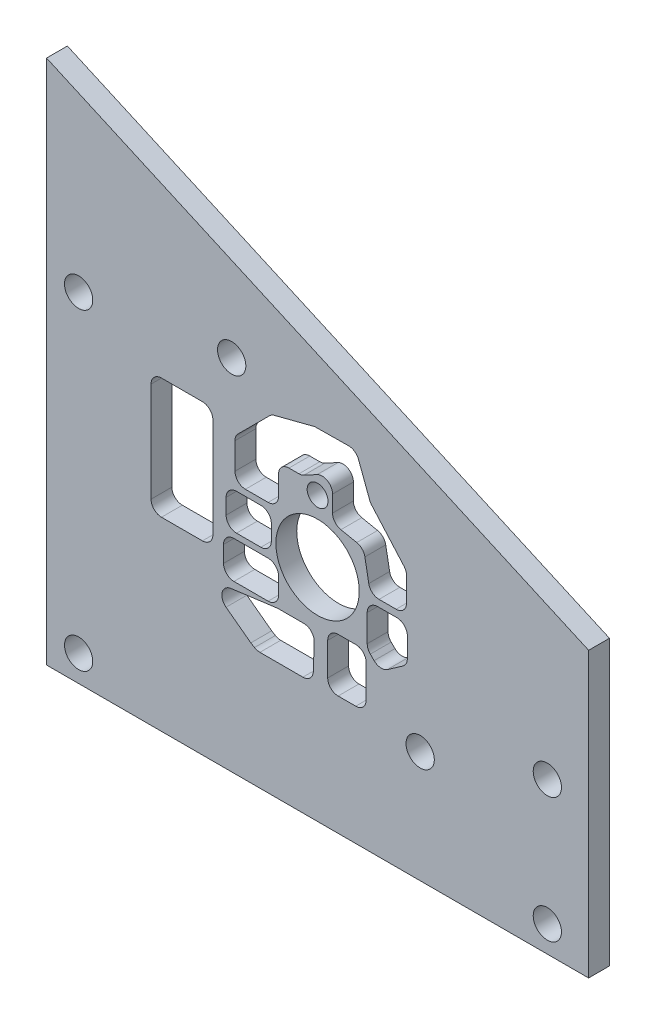
from build123d import *

# Parameters (mm, degrees)
BOSS_EXTRUDE1_DEPTH          = 3.175
F_6_CLEARANCE_HOLE1_D        = 4.3053
F_1_2_0_5_DIAMETER_HOLE1_D   = 12.7
F_1_8_0_125_DIAMETER_HOLE1_D = 3.175
CUT_EXTRUDE1_DEPTH           = 127.083883288
SKETCH10_W                   = 82.55
SKETCH10_H                   = 13.462
CUT_EXTRUDE2_DEPTH           = 125.775859018
CUT_EXTRUDE3_DEPTH           = 125.775859018


with BuildPart() as part:
    # Sketch1 → Boss-Extrude1 (new body)
    with BuildSketch(Plane.XY):
        with BuildLine():
            Line((49.022, 13.462), (57.658, 13.462))
            ThreePointArc((57.658, 13.462), (61.250102448, 11.974102448), (62.738, 8.382))
            Line((62.738, 8.382), (62.738, 0))
            Line((62.738, 0), (82.55, 0))
            Line((82.55, 0), (82.55, 58.42))
            Line((82.55, 58.42), (0, 95.25))
            Line((0, 95.25), (0, 0))
            Line((0, 0), (43.942, 0))
            Line((43.942, 0), (43.942, 8.382))
            ThreePointArc((43.942, 8.382), (45.429897552, 11.974102448), (49.022, 13.462))
        make_face()
    extrude(amount=-BOSS_EXTRUDE1_DEPTH)

    # #6 Clearance Hole1 (through all)
    with Locations(Plane(origin=(0, 0, -3.175), x_dir=(-1, 0, 0), z_dir=(0, 0, -1))):
        with Locations((-4.8895, 17.4625), (-4.8895, 65.0875), (-76.2635, 36.5125), (-76.2635, 17.4625), (-28.194, 68.072), (-56.896, 30.48)):
            Hole(F_6_CLEARANCE_HOLE1_D / 2)

    # 1/2 (0.5) Diameter Hole1 (through all)
    with Locations(Plane(origin=(0, 0, -3.175), x_dir=(-1, 0, 0), z_dir=(0, 0, -1))):
        with Locations((-41.275, 46.99)):
            Hole(F_1_2_0_5_DIAMETER_HOLE1_D / 2)

    # 1/8 (0.125) Diameter Hole1 (through all)
    with Locations(Plane.XY):
        with Locations((41.275, 56.488873013)):
            Hole(F_1_8_0_125_DIAMETER_HOLE1_D / 2)

    # Sketch9 → Cut-Extrude1 (cut, through all)
    with BuildSketch(Plane.XY):
        Polygon((82.55, 56.681667019), (0, 93.511667019), (0, 95.25), (82.55, 58.42), align=None)
    extrude(amount=-CUT_EXTRUDE1_DEPTH, mode=Mode.SUBTRACT)

    # Sketch10 → Cut-Extrude2 (cut, through all)
    with BuildSketch(Plane.XY):
        with Locations((41.275, 6.731)):
            Rectangle(SKETCH10_W, SKETCH10_H)
    extrude(amount=-CUT_EXTRUDE2_DEPTH, mode=Mode.SUBTRACT)

    # Sketch11 → Cut-Extrude3 (cut, through all)
    with BuildSketch(Plane(origin=(0, 0, -3.175), x_dir=(-1, 0, 0), z_dir=(0, 0, -1))):
        with BuildLine():
            Line((-47.499382893, 64.350043571), (-49.217838976, 59.797014184))
            ThreePointArc((-49.217838976, 59.797014184), (-49.342602584, 59.539490696), (-49.511570199, 59.308548605))
            Line((-49.511570199, 59.308548605), (-54.424737937, 53.728160557))
            ThreePointArc((-54.424737937, 53.728160557), (-54.718441496, 53.239768266), (-54.820737184, 52.679121851))
            Line((-54.820737184, 52.679121851), (-54.820737184, 49.028223087))
            ThreePointArc((-54.820737184, 49.028223087), (-54.355769199, 47.905691072), (-53.233237184, 47.440723087))
            Line((-53.233237184, 47.440723087), (-50.632018094, 47.440723087))
            ThreePointArc((-50.632018094, 47.440723087), (-49.615422508, 47.808924245), (-49.070400683, 48.742728232))
            Line((-49.070400683, 48.742728232), (-48.481044321, 51.966426108))
            ThreePointArc((-48.481044321, 51.966426108), (-48.053344478, 52.791961047), (-47.236701236, 53.236403289))
            Line((-47.236701236, 53.236403289), (-44.826272839, 53.728065645))
            ThreePointArc((-44.826272839, 53.728065645), (-43.913947791, 54.279425321), (-43.556047165, 55.28353768))
            Line((-43.556047165, 55.28353768), (-43.556047165, 57.78867138))
            ThreePointArc((-43.556047165, 57.78867138), (-42.781378772, 59.152291939), (-41.213419098, 59.185073132))
            Line((-41.213419098, 59.185073132), (-39.194265812, 58.093181549))
            ThreePointArc((-39.194265812, 58.093181549), (-38.828604347, 57.950599215), (-38.439137744, 57.902083301))
            Line((-38.439137744, 57.902083301), (-36.91898292, 57.902083301))
            ThreePointArc((-36.91898292, 57.902083301), (-35.796450905, 57.437115316), (-35.33148292, 56.314583301))
            Line((-35.33148292, 56.314583301), (-35.33148292, 53.371319843))
            ThreePointArc((-35.33148292, 53.371319843), (-34.866514936, 52.248787828), (-33.74398292, 51.783819843))
            Line((-33.74398292, 51.783819843), (-30.284464792, 51.783819843))
            ThreePointArc((-30.284464792, 51.783819843), (-29.161932777, 52.248787828), (-28.696964792, 53.371319843))
            Line((-28.696964792, 53.371319843), (-28.696964792, 57.39464551))
            ThreePointArc((-28.696964792, 57.39464551), (-28.817806034, 58.002155459), (-29.161932777, 58.517177525))
            Line((-29.161932777, 58.517177525), (-33.960282123, 63.315526871))
            ThreePointArc((-33.960282123, 63.315526871), (-34.294903906, 63.571165279), (-34.684964472, 63.729833134))
            Line((-34.684964472, 63.729833134), (-40.63768141, 65.270845279))
            ThreePointArc((-40.63768141, 65.270845279), (-40.826231645, 65.307649272), (-41.017846908, 65.3214085))
            Line((-41.017846908, 65.3214085), (-45.99646675, 65.376871943))
            ThreePointArc((-45.99646675, 65.376871943), (-46.909705645, 65.100248069), (-47.499382893, 64.350043571))
        make_face()
        with BuildLine():
            Line((-32.646432346, 50.840755102), (-28.930085764, 50.840755102))
            ThreePointArc((-28.930085764, 50.840755102), (-27.807553749, 50.375787118), (-27.342585764, 49.253255102))
            Line((-27.342585764, 49.253255102), (-27.342585764, 46.905517071))
            ThreePointArc((-27.342585764, 46.905517071), (-27.807553749, 45.782985055), (-28.930085764, 45.318017071))
            Line((-28.930085764, 45.318017071), (-32.646432346, 45.318017071))
            ThreePointArc((-32.646432346, 45.318017071), (-33.768964361, 45.782985055), (-34.233932346, 46.905517071))
            Line((-34.233932346, 46.905517071), (-34.233932346, 49.253255102))
            ThreePointArc((-34.233932346, 49.253255102), (-33.768964361, 50.375787118), (-32.646432346, 50.840755102))
        make_face()
        with BuildLine():
            Line((-35.33148292, 42.840265572), (-35.33148292, 40.343410335))
            ThreePointArc((-35.33148292, 40.343410335), (-34.866514936, 39.22087832), (-33.74398292, 38.755910335))
            Line((-33.74398292, 38.755910335), (-28.540105865, 38.755910335))
            ThreePointArc((-28.540105865, 38.755910335), (-27.41757385, 39.22087832), (-26.952605865, 40.343410335))
            Line((-26.952605865, 40.343410335), (-26.952605865, 42.840265572))
            ThreePointArc((-26.952605865, 42.840265572), (-27.41757385, 43.962797587), (-28.540105865, 44.427765572))
            Line((-28.540105865, 44.427765572), (-33.74398292, 44.427765572))
            ThreePointArc((-33.74398292, 44.427765572), (-34.866514936, 43.962797587), (-35.33148292, 42.840265572))
        make_face()
        with BuildLine():
            Line((-39.176026782, 38.541010778), (-35.285472725, 38.541010778))
            ThreePointArc((-35.285472725, 38.541010778), (-35.181229503, 38.537584514), (-35.077436253, 38.527320512))
            Line((-35.077436253, 38.527320512), (-28.074427945, 37.601617035))
            ThreePointArc((-28.074427945, 37.601617035), (-26.745966883, 36.426970902), (-27.33471779, 34.754256132))
            Line((-27.33471779, 34.754256132), (-31.114583127, 31.941369845))
            Line((-31.114583127, 31.941369845), (-31.672176066, 31.606780028))
            ThreePointArc((-31.672176066, 31.606780028), (-32.065207793, 31.438125436), (-32.488999204, 31.38051337))
            Line((-32.488999204, 31.38051337), (-39.038910223, 31.38051337))
            ThreePointArc((-39.038910223, 31.38051337), (-40.141975129, 31.82634614), (-40.625471552, 32.913429511))
            Line((-40.625471552, 32.913429511), (-40.762588111, 36.898926919))
            ThreePointArc((-40.762588111, 36.898926919), (-40.317694012, 38.056575684), (-39.176026782, 38.541010778))
        make_face()
        with BuildLine():
            Line((-42.817574391, 33.165238566), (-42.817574391, 38.125040876))
            ThreePointArc((-42.817574391, 38.125040876), (-43.282542376, 39.247572891), (-44.405074391, 39.712540876))
            Line((-44.405074391, 39.712540876), (-47.083309533, 39.712540876))
            ThreePointArc((-47.083309533, 39.712540876), (-48.205841548, 39.247572891), (-48.670809533, 38.125040876))
            Line((-48.670809533, 38.125040876), (-48.670809533, 33.165238566))
            ThreePointArc((-48.670809533, 33.165238566), (-48.205841548, 32.042706551), (-47.083309533, 31.577738566))
            Line((-47.083309533, 31.577738566), (-44.405074391, 31.577738566))
            ThreePointArc((-44.405074391, 31.577738566), (-43.282542376, 32.042706551), (-42.817574391, 33.165238566))
        make_face()
        with BuildLine():
            Line((-49.887230399, 38.986758496), (-49.307899355, 39.555613781))
            ThreePointArc((-49.307899355, 39.555613781), (-48.956271181, 40.074146218), (-48.832643382, 40.688340347))
            Line((-48.832643382, 40.688340347), (-48.832643382, 44.797069188))
            ThreePointArc((-48.832643382, 44.797069188), (-49.297611367, 45.919601203), (-50.420143382, 46.384569188))
            Line((-50.420143382, 46.384569188), (-53.357849589, 46.384569188))
            ThreePointArc((-53.357849589, 46.384569188), (-54.480381604, 45.919601203), (-54.945349589, 44.797069188))
            Line((-54.945349589, 44.797069188), (-54.945349589, 41.767945485))
            ThreePointArc((-54.945349589, 41.767945485), (-54.76567745, 41.03434003), (-54.267331367, 40.466792479))
            Line((-54.267331367, 40.466792479), (-51.908956205, 38.818332055))
            ThreePointArc((-51.908956205, 38.818332055), (-50.867679135, 38.537465387), (-49.887230399, 38.986758496))
        make_face()
        with BuildLine():
            Line((-25.32846817, 58.474673246), (-25.32846817, 43.293720989))
            ThreePointArc((-25.32846817, 43.293720989), (-24.863500186, 42.171188974), (-23.74096817, 41.706220989))
            Line((-23.74096817, 41.706220989), (-17.504158256, 41.706220989))
            ThreePointArc((-17.504158256, 41.706220989), (-16.38162624, 42.171188974), (-15.916658256, 43.293720989))
            Line((-15.916658256, 43.293720989), (-15.916658256, 58.474673246))
            ThreePointArc((-15.916658256, 58.474673246), (-16.38162624, 59.597205261), (-17.504158256, 60.062173246))
            Line((-17.504158256, 60.062173246), (-23.74096817, 60.062173246))
            ThreePointArc((-23.74096817, 60.062173246), (-24.863500186, 59.597205261), (-25.32846817, 58.474673246))
        make_face()
    extrude(amount=-CUT_EXTRUDE3_DEPTH, mode=Mode.SUBTRACT)


solid = part.part
